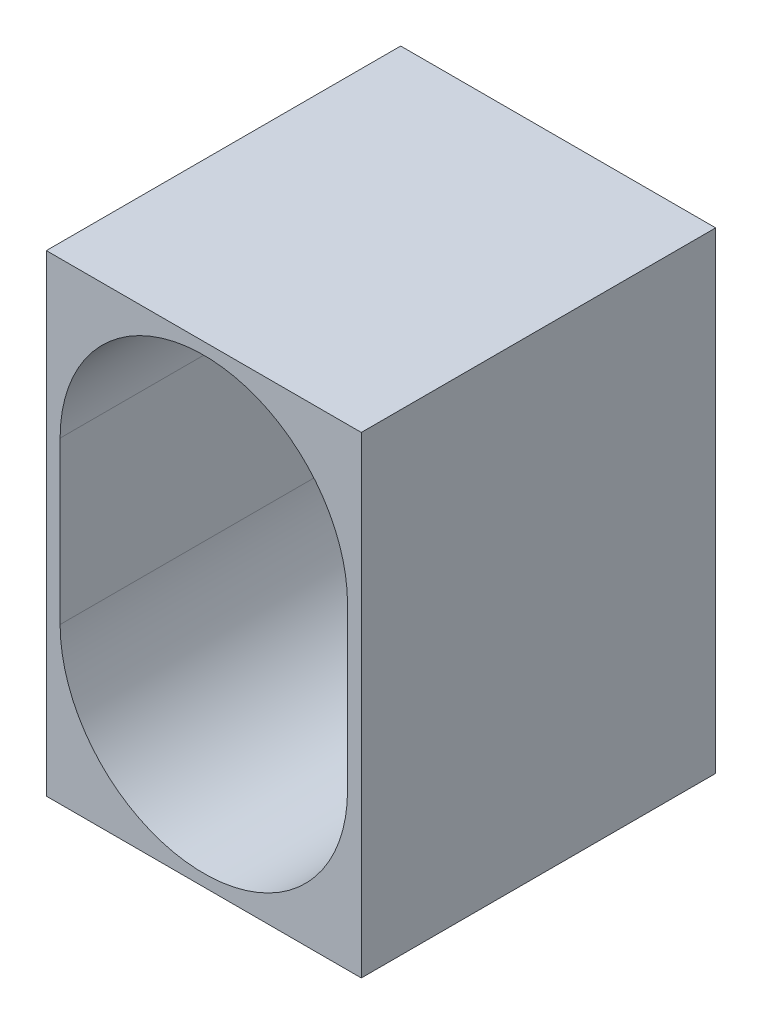
from build123d import *

# Parameters (mm, degrees)
SKETCH4_W           = 40
SKETCH4_H           = 60
BOSS_EXTRUDE2_DEPTH = 45
CUT_EXTRUDE1_DEPTH  = 42.5


with BuildPart() as part:
    # Sketch4 → Boss-Extrude2 (new body)
    with BuildSketch(Plane.XY):
        with Locations((-5.284904398, -9.439291809)):
            Rectangle(SKETCH4_W, SKETCH4_H)
    extrude(amount=BOSS_EXTRUDE2_DEPTH)

    # Sketch5 → Cut-Extrude1 (cut)
    with BuildSketch(Plane.XY.offset(45)):
        with BuildLine():
            Line((-23.534904398, -19.689291809), (-23.534904398, 0.810708191))
            ThreePointArc((-23.534904398, 0.810708191), (-5.284904398, 19.060708191), (12.965095602, 0.810708191))
            Line((12.965095602, 0.810708191), (12.965095602, -19.689291809))
            ThreePointArc((12.965095602, -19.689291809), (-5.284904398, -37.939291809), (-23.534904398, -19.689291809))
        make_face()
    extrude(amount=-CUT_EXTRUDE1_DEPTH, mode=Mode.SUBTRACT)


solid = part.part
